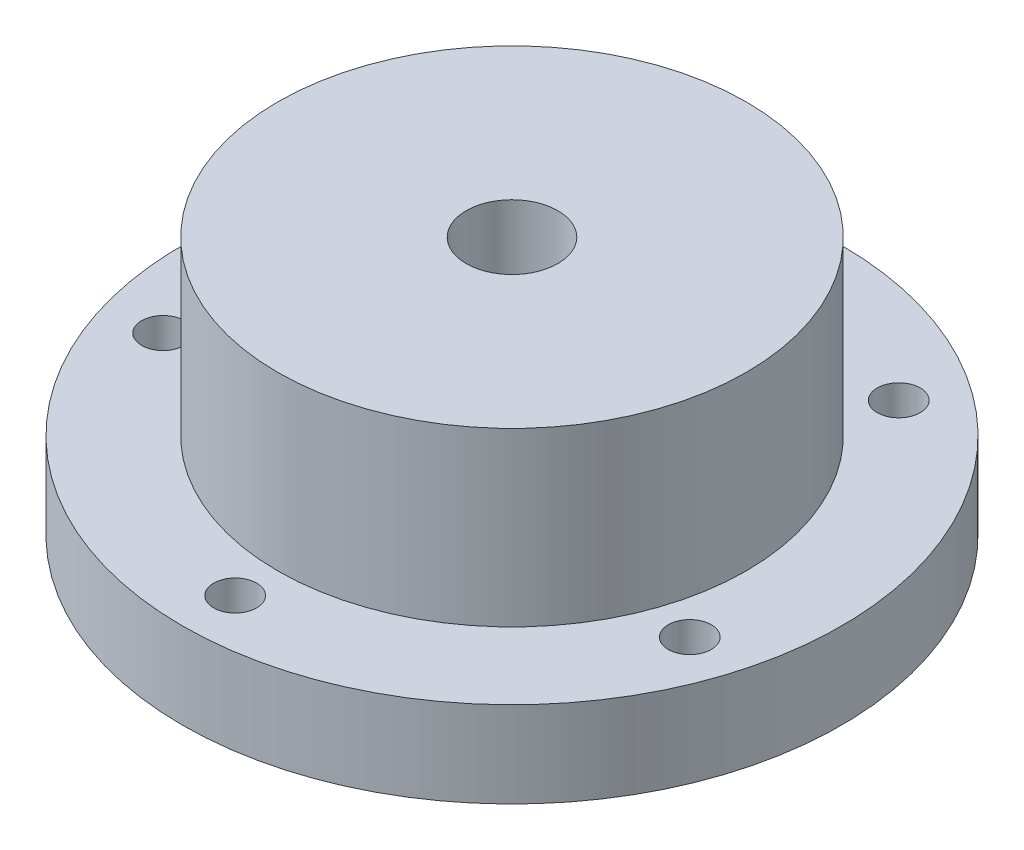
from build123d import *

# Parameters (mm, degrees)
BOSS_EXTRUDE1_DEPTH      = 6
BOSS_EXTRUDE1_DEPTH_BACK = 3
SKETCH1_R                = 8.175
SKETCH1_R_2              = 1.6
SKETCH1_3_R              = 11.5
SKETCH1_3_R_2            = 8.175
BOSS_EXTRUDE2_DEPTH      = 3
SKETCH2_R                = 1
CUT_EXTRUDE1_DEPTH       = 15
SKETCH4_R                = 3.5
BOSS_EXTRUDE3_DEPTH      = 5
SKETCH1_7_R              = 1.6
CUT_EXTRUDE2_DEPTH       = 13
SKETCH3_R                = 0.75
CUT_EXTRUDE3_DEPTH       = 10


with BuildPart() as part:
    # Sketch1 → Boss-Extrude1 (new, two sides: drawn at the far end of the back side and taken through both)
    with BuildSketch(Plane(origin=(0, 0, 0), x_dir=(1, 0, 0), z_dir=(0, 1, 0)).offset(-BOSS_EXTRUDE1_DEPTH_BACK)):
        Circle(SKETCH1_R)
        Circle(SKETCH1_R_2, mode=Mode.SUBTRACT)
    extrude(amount=BOSS_EXTRUDE1_DEPTH + BOSS_EXTRUDE1_DEPTH_BACK)

    # Sketch2 → Cut-Extrude1 (cut)
    with BuildSketch(Plane(origin=(0, 0, 0), x_dir=(0, 0, -1), z_dir=(1, 0, 0))):
        with Locations((0, 3)):
            Circle(SKETCH2_R)
    extrude(amount=-CUT_EXTRUDE1_DEPTH, mode=Mode.SUBTRACT)


with BuildPart() as body_2:
    # Sketch1<3> → Boss-Extrude2 (new body)
    with BuildSketch(Plane(origin=(0, 0, 0), x_dir=(1, 0, 0), z_dir=(0, 1, 0))):
        Circle(SKETCH1_3_R)
        Circle(SKETCH1_3_R_2, mode=Mode.SUBTRACT)
    extrude(amount=-BOSS_EXTRUDE2_DEPTH)


    add(part.part)  # Boss-Extrude3 merges part
    # Sketch4 → Boss-Extrude3 (add)
    with BuildSketch(Plane.XZ.offset(3)):
        Circle(SKETCH4_R)
    extrude(amount=BOSS_EXTRUDE3_DEPTH)

    # Sketch1<7> → Cut-Extrude2 (cut)
    with BuildSketch(Plane(origin=(0, 0, 0), x_dir=(1, 0, 0), z_dir=(0, 1, 0))):
        Circle(SKETCH1_7_R)
    extrude(amount=-CUT_EXTRUDE2_DEPTH, mode=Mode.SUBTRACT)

    # Sketch3 → Cut-Extrude3 (cut)
    with BuildSketch(Plane.XZ.offset(3)):
        with Locations((0, 9.661253085)):
            Circle(SKETCH3_R)
        with Locations((9.188397702, 2.98549139)):
            Circle(SKETCH3_R)
        with Locations((5.678742082, -7.816117933)):
            Circle(SKETCH3_R)
        with Locations((-5.678742082, -7.816117933)):
            Circle(SKETCH3_R)
        with Locations((-9.188397702, 2.98549139)):
            Circle(SKETCH3_R)
    extrude(amount=-CUT_EXTRUDE3_DEPTH, mode=Mode.SUBTRACT)


solid = body_2.part
